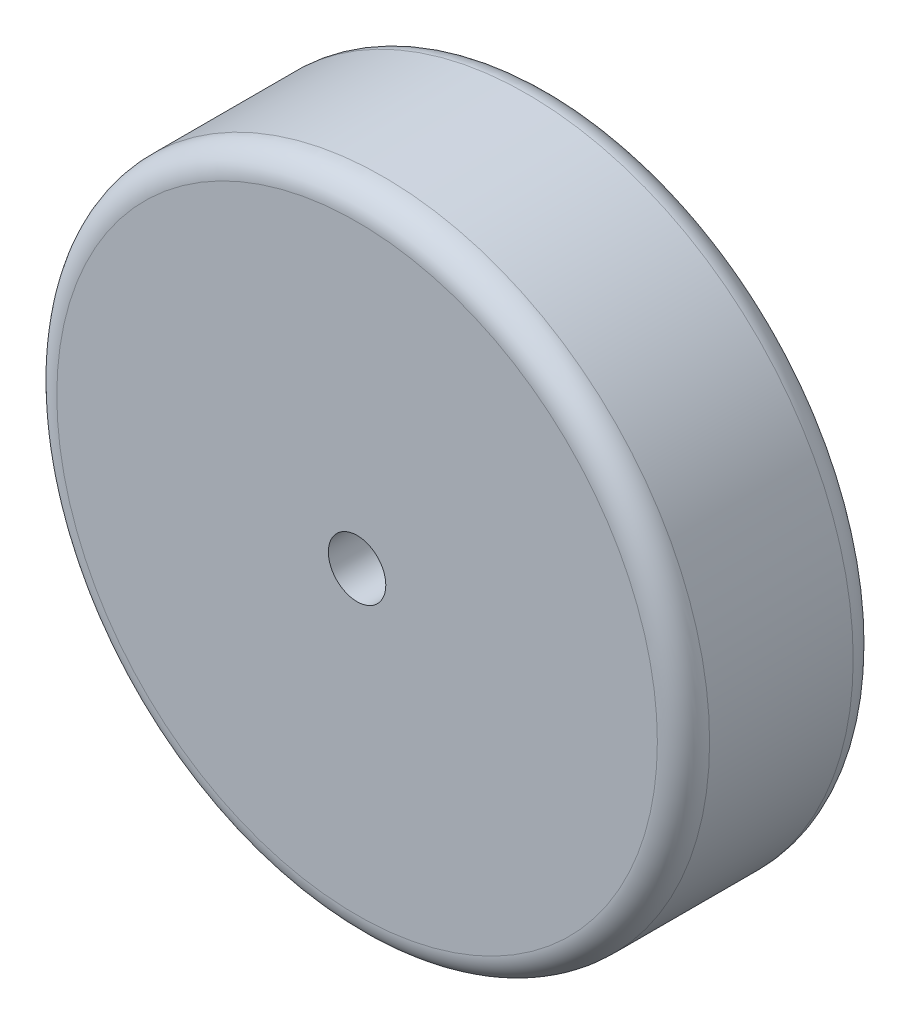
from build123d import *

# Parameters (mm, degrees)
SKETCH1_R           = 25
BOSS_EXTRUDE1_DEPTH = 15
FILLET1_R           = 2
SKETCH7_R           = 2.2
CUT_EXTRUDE2_DEPTH  = 39.405728804


with BuildPart() as part:
    # Sketch1 → Boss-Extrude1 (new body)
    with BuildSketch(Plane.XY):
        Circle(SKETCH1_R)
    extrude(amount=BOSS_EXTRUDE1_DEPTH)

    # Fillet1
    fillet1_edges = [part.edges().sort_by_distance(p)[0] for p in [
        (-25, 0, 15),
        (-25, 0, 0),
    ]]
    fillet(fillet1_edges, radius=FILLET1_R)

    # Sketch7 → Cut-Extrude2 (cut, through all)
    with BuildSketch(Plane.XY.offset(15)):
        Circle(SKETCH7_R)
    extrude(amount=-CUT_EXTRUDE2_DEPTH, mode=Mode.SUBTRACT)


solid = part.part
